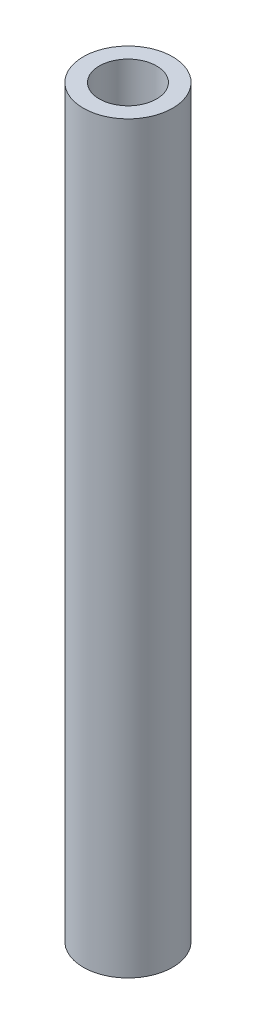
from build123d import *

# Parameters (mm, degrees)
ESQUISSE1_R             = 6
BOSS_EXTRU_1_DEPTH      = 100
ESQUISSE1_3_R           = 3.85
ENL_V_MAT_EXTRU_1_DEPTH = 100


with BuildPart() as part:
    # Esquisse1 → Boss.-Extru.1 (new body)
    with BuildSketch(Plane(origin=(0, 0, 0), x_dir=(1, 0, 0), z_dir=(0, 1, 0))):
        with Locations((-34.390392651, -12.56102994)):
            Circle(ESQUISSE1_R)
    extrude(amount=BOSS_EXTRU_1_DEPTH)

    # Esquisse1<3> → Enlèv. mat.-Extru.1 (cut)
    with BuildSketch(Plane(origin=(0, 0, 0), x_dir=(1, 0, 0), z_dir=(0, 1, 0))):
        with Locations((-34.390392651, -12.56102994)):
            Circle(ESQUISSE1_3_R)
    extrude(amount=ENL_V_MAT_EXTRU_1_DEPTH, mode=Mode.SUBTRACT)


solid = part.part
